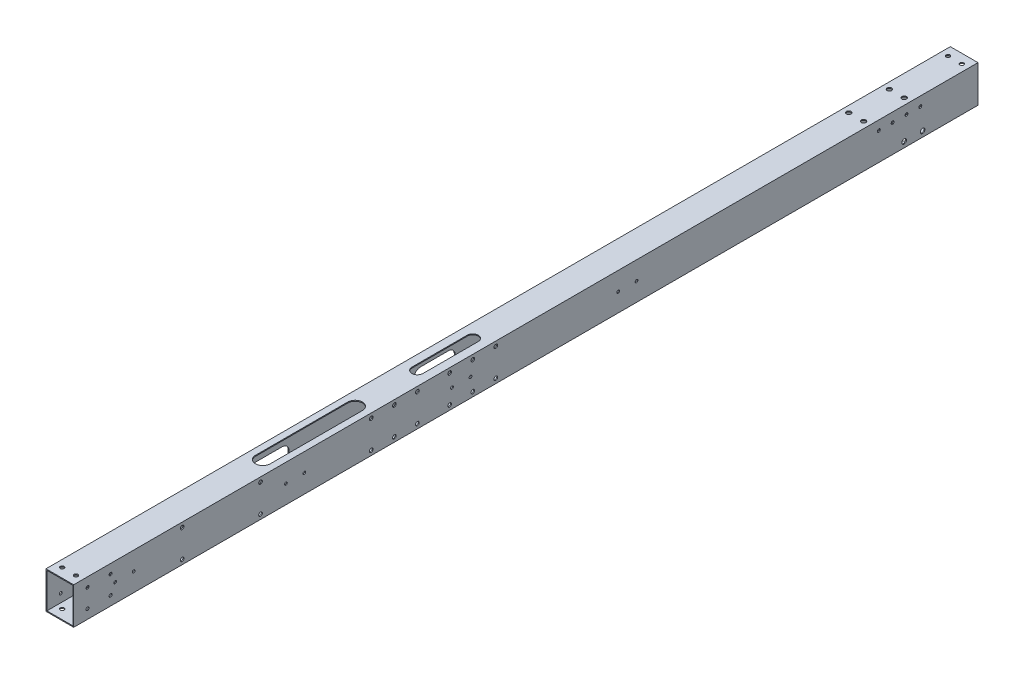
from build123d import *

# Parameters (mm, degrees)
SKETCH_1_W           = 30
SKETCH_1_H           = 40
SKETCH_1_W_2         = 28
SKETCH_1_H_2         = 38
EXTRUDE_1_DEPTH      = 940
SKETCH_5_R           = 2.5
CUT_EXTRUDE_3_DEPTH  = 941.97024395
CUT_EXTRUDE_4_DEPTH  = 1
SKETCH_7_R           = 1.5
CUT_EXTRUDE_5_DEPTH  = 1
SKETCH_17_W          = 30
SKETCH_17_H          = 40
SKETCH_17_W_2        = 28
SKETCH_17_H_2        = 38
EXTRUDE_2_DEPTH      = 20
SKETCH_18_W          = 30
SKETCH_18_H          = 40
SKETCH_18_W_2        = 28
SKETCH_18_H_2        = 38
EXTRUDE_3_DEPTH      = 20
SKETCH_19_R          = 2.1
CUT_EXTRUDE_16_DEPTH = 961.950050731
SKETCH_20_R          = 1.6
CUT_EXTRUDE_17_DEPTH = 961.67684473
SKETCH_21_R          = 2.5
SKETCH_21_R_2        = 1.6
CUT_EXTRUDE_18_DEPTH = 961.67684473
SKETCH_23_R          = 2.5
CUT_EXTRUDE_19_DEPTH = 961.950050731
SKETCH_24_R          = 4.5
CUT_EXTRUDE_20_DEPTH = 10
SKETCH_25_W          = 114.67616049
SKETCH_25_H          = 1154.562704257
CUT_EXTRUDE_21_DEPTH = 968.690549711
SKETCH_26_R          = 2
CUT_EXTRUDE_22_DEPTH = 961.67684473
CUT_EXTRUDE_23_DEPTH = 10
SKETCH_28_R          = 1.5
CUT_EXTRUDE_24_DEPTH = 10
SKETCH_29_R          = 1.5
CUT_EXTRUDE_25_DEPTH = 10
CUT_EXTRUDE_26_DEPTH = 10


with BuildPart() as part:
    # 草图1 → 凸台-拉伸1 (new body)
    with BuildSketch(Plane.XY):
        Rectangle(SKETCH_1_W, SKETCH_1_H)
        Rectangle(SKETCH_1_W_2, SKETCH_1_H_2, mode=Mode.SUBTRACT)
    extrude(amount=EXTRUDE_1_DEPTH)

    # 草图5 → 切除-拉伸3 (cut, through all)
    with BuildSketch(Plane.XZ.offset(20)):
        with Locations((-8, 53)):
            Circle(SKETCH_5_R)
        with Locations((8, 53)):
            Circle(SKETCH_5_R)
        with Locations((-8, 97)):
            Circle(SKETCH_5_R)
        with Locations((8, 97)):
            Circle(SKETCH_5_R)
    extrude(amount=-CUT_EXTRUDE_3_DEPTH, mode=Mode.SUBTRACT)

    # 草图6 → 切除-拉伸4 (cut)
    with BuildSketch(Plane(origin=(15, 0, 0), x_dir=(0, 0, -1), z_dir=(1, 0, 0))):
        with BuildLine():
            Line((-345, -7.5), (-375, -7.5))
            ThreePointArc((-375, -7.5), (-382.5, 0), (-375, 7.5))
            Line((-375, 7.5), (-345, 7.5))
            ThreePointArc((-345, 7.5), (-337.5, 0), (-345, -7.5))
        make_face()
        with BuildLine():
            Line((-525, -7.5), (-555, -7.5))
            ThreePointArc((-555, -7.5), (-562.5, 0), (-555, 7.5))
            Line((-555, 7.5), (-525, 7.5))
            ThreePointArc((-525, 7.5), (-517.5, 0), (-525, -7.5))
        make_face()
        with BuildLine():
            Line((-705, -7.5), (-735, -7.5))
            ThreePointArc((-735, -7.5), (-742.5, 0), (-735, 7.5))
            Line((-735, 7.5), (-705, 7.5))
            ThreePointArc((-705, 7.5), (-697.5, 0), (-705, -7.5))
        make_face()
    extrude(amount=-CUT_EXTRUDE_4_DEPTH, mode=Mode.SUBTRACT)

    # 草图7 → 切除-拉伸5 (cut)
    with BuildSketch(Plane.ZY.offset(15)):
        with Locations((350, 0)):
            Circle(SKETCH_7_R)
        with Locations((370, 0)):
            Circle(SKETCH_7_R)
        with Locations((530, 0)):
            Circle(SKETCH_7_R)
        with Locations((550, 0)):
            Circle(SKETCH_7_R)
        with Locations((710, 0)):
            Circle(SKETCH_7_R)
        with Locations((730, 0)):
            Circle(SKETCH_7_R)
    extrude(amount=-CUT_EXTRUDE_5_DEPTH, mode=Mode.SUBTRACT)

    # 草图17 → 凸台-拉伸2 (add)
    with BuildSketch(Plane.XY.offset(940)):
        Rectangle(SKETCH_17_W, SKETCH_17_H)
        Rectangle(SKETCH_17_W_2, SKETCH_17_H_2, mode=Mode.SUBTRACT)
    extrude(amount=EXTRUDE_2_DEPTH)

    # 草图18 → 凸台-拉伸3 (add)
    with BuildSketch(Plane(origin=(0, 0, 0), x_dir=(-1, 0, 0), z_dir=(0, 0, -1))):
        Rectangle(SKETCH_18_W, SKETCH_18_H)
        Rectangle(SKETCH_18_W_2, SKETCH_18_H_2, mode=Mode.SUBTRACT)
    extrude(amount=EXTRUDE_3_DEPTH)

    # 草图19 → 切除-拉伸16 (cut, through all)
    with BuildSketch(Plane(origin=(0, 20, 0), x_dir=(1, 0, 0), z_dir=(0, 1, 0))):
        with Locations((-7.5, -950)):
            Circle(SKETCH_19_R)
        with Locations((7.5, -950)):
            Circle(SKETCH_19_R)
        with Locations((-7.5, 10)):
            Circle(SKETCH_19_R)
        with Locations((7.5, 10)):
            Circle(SKETCH_19_R)
    extrude(amount=-CUT_EXTRUDE_16_DEPTH, mode=Mode.SUBTRACT)

    # 草图20 → 切除-拉伸17 (cut, through all)
    with BuildSketch(Plane(origin=(15, 0, 0), x_dir=(0, 0, -1), z_dir=(1, 0, 0))):
        with Locations((-945, 10)):
            Circle(SKETCH_20_R)
        with Locations((-920, 10)):
            Circle(SKETCH_20_R)
        with Locations((-920, -10)):
            Circle(SKETCH_20_R)
        with Locations((-945, -10)):
            Circle(SKETCH_20_R)
    extrude(amount=-CUT_EXTRUDE_17_DEPTH, mode=Mode.SUBTRACT)

    # 草图21 → 切除-拉伸18 (cut, through all)
    with BuildSketch(Plane(origin=(15, 0, 0), x_dir=(0, 0, -1), z_dir=(1, 0, 0))):
        with Locations((-40, -14)):
            Circle(SKETCH_21_R)
        with Locations((-60, -14)):
            Circle(SKETCH_21_R)
        with Locations((-42.5, 10)):
            Circle(SKETCH_21_R_2)
        with Locations((-57.5, 10)):
            Circle(SKETCH_21_R_2)
        with Locations((-72.5, 10)):
            Circle(SKETCH_21_R_2)
        with Locations((-87.5, 10)):
            Circle(SKETCH_21_R_2)
    extrude(amount=-CUT_EXTRUDE_18_DEPTH, mode=Mode.SUBTRACT)

    # 草图23 → 切除-拉伸19 (cut, through all)
    with BuildSketch(Plane(origin=(0, 20, 0), x_dir=(1, 0, 0), z_dir=(0, 1, 0))):
        with Locations((0, -520)):
            Circle(SKETCH_23_R)
        with Locations((0, -535)):
            Circle(SKETCH_23_R)
        with Locations((0, -550)):
            Circle(SKETCH_23_R)
        with Locations((0, -565)):
            Circle(SKETCH_23_R)
    extrude(amount=-CUT_EXTRUDE_19_DEPTH, mode=Mode.SUBTRACT)

    # 草图24 → 切除-拉伸20 (cut)
    with BuildSketch(Plane(origin=(0, 20, 0), x_dir=(1, 0, 0), z_dir=(0, 1, 0))):
        with Locations((0, -520)):
            Circle(SKETCH_24_R)
        with Locations((0, -535)):
            Circle(SKETCH_24_R)
        with Locations((0, -550)):
            Circle(SKETCH_24_R)
        with Locations((0, -565)):
            Circle(SKETCH_24_R)
    extrude(amount=-CUT_EXTRUDE_20_DEPTH, mode=Mode.SUBTRACT)


with BuildPart() as body_2:
    # 镜向2: mirrored copy
    add(part.part.mirror(Plane(origin=(-50, 0, 0), x_dir=(0, 0, 1), z_dir=(1, 0, 0))))

    # 草图26 → 切除-拉伸22 (cut, through all)
    with BuildSketch(Plane.ZY.offset(115)):
        with Locations((612.5, 15)):
            Circle(SKETCH_26_R)
        with Locations((612.5, -15)):
            Circle(SKETCH_26_R)
        with Locations((527.5, 15)):
            Circle(SKETCH_26_R)
        with Locations((527.5, -15)):
            Circle(SKETCH_26_R)
        with Locations((842.5, 15)):
            Circle(SKETCH_26_R)
        with Locations((842.5, -15)):
            Circle(SKETCH_26_R)
        with Locations((757.5, 15)):
            Circle(SKETCH_26_R)
        with Locations((757.5, -15)):
            Circle(SKETCH_26_R)
        with Locations((637.5, 15)):
            Circle(SKETCH_26_R)
        with Locations((637.5, -15)):
            Circle(SKETCH_26_R)
        with Locations((552.5, -15)):
            Circle(SKETCH_26_R)
        with Locations((552.5, 15)):
            Circle(SKETCH_26_R)
        with Locations((502.5, 15)):
            Circle(SKETCH_26_R)
        with Locations((502.5, -15)):
            Circle(SKETCH_26_R)
        with Locations((587.5, -15)):
            Circle(SKETCH_26_R)
        with Locations((587.5, 15)):
            Circle(SKETCH_26_R)
    extrude(amount=-CUT_EXTRUDE_22_DEPTH, mode=Mode.SUBTRACT)

    # 草图27 → 切除-拉伸23 (cut)
    with BuildSketch(Plane(origin=(0, 20, 0), x_dir=(1, 0, 0), z_dir=(0, 1, 0))):
        with BuildLine():
            Line((-94, -512.5), (-94, -572.5))
            ThreePointArc((-94, -572.5), (-100, -578.5), (-106, -572.5))
            Line((-106, -572.5), (-106, -512.5))
            ThreePointArc((-106, -512.5), (-100, -506.5), (-94, -512.5))
        make_face()
    extrude(amount=-CUT_EXTRUDE_23_DEPTH, mode=Mode.SUBTRACT)

    # 草图28 → 切除-拉伸24 (cut)
    with BuildSketch(Plane(origin=(-85, 0, 0), x_dir=(0, 0, -1), z_dir=(1, 0, 0))):
        with Locations((-730, 0)):
            Circle(SKETCH_28_R)
        with Locations((-710, 0)):
            Circle(SKETCH_28_R)
        with Locations((-915, 0)):
            Circle(SKETCH_28_R)
        with Locations((-895, 0)):
            Circle(SKETCH_28_R)
    extrude(amount=-CUT_EXTRUDE_24_DEPTH, mode=Mode.SUBTRACT)

    # 草图29 → 切除-拉伸25 (cut)
    with BuildSketch(Plane.XZ.offset(20)):
        with Locations((-105, 740)):
            Circle(SKETCH_29_R)
        with Locations((-105, 720)):
            Circle(SKETCH_29_R)
        with Locations((-105, 700)):
            Circle(SKETCH_29_R)
        with Locations((-105, 680)):
            Circle(SKETCH_29_R)
        with Locations((-105, 660)):
            Circle(SKETCH_29_R)
        with Locations((-105, 640)):
            Circle(SKETCH_29_R)
        with Locations((-105, 620)):
            Circle(SKETCH_29_R)
    extrude(amount=-CUT_EXTRUDE_25_DEPTH, mode=Mode.SUBTRACT)

    # 草图30 → 切除-拉伸26 (cut)
    with BuildSketch(Plane(origin=(0, 20, 0), x_dir=(1, 0, 0), z_dir=(0, 1, 0))):
        with BuildLine():
            Line((-92, -640), (-92, -740))
            ThreePointArc((-92, -740), (-100, -748), (-108, -740))
            Line((-108, -740), (-108, -640))
            ThreePointArc((-108, -640), (-100, -632), (-92, -640))
        make_face()
    extrude(amount=-CUT_EXTRUDE_26_DEPTH, mode=Mode.SUBTRACT)


with BuildPart() as part_1:
    add(part.part)

    # 草图25 → 切除-拉伸21 (cut, through all)
    with BuildSketch(Plane(origin=(0, 20, 0), x_dir=(1, 0, 0), z_dir=(0, 1, 0))):
        with Locations((7.338080245, -506.215166959)):
            Rectangle(SKETCH_25_W, SKETCH_25_H)
    extrude(amount=-CUT_EXTRUDE_21_DEPTH, mode=Mode.SUBTRACT)


solid = body_2.part
